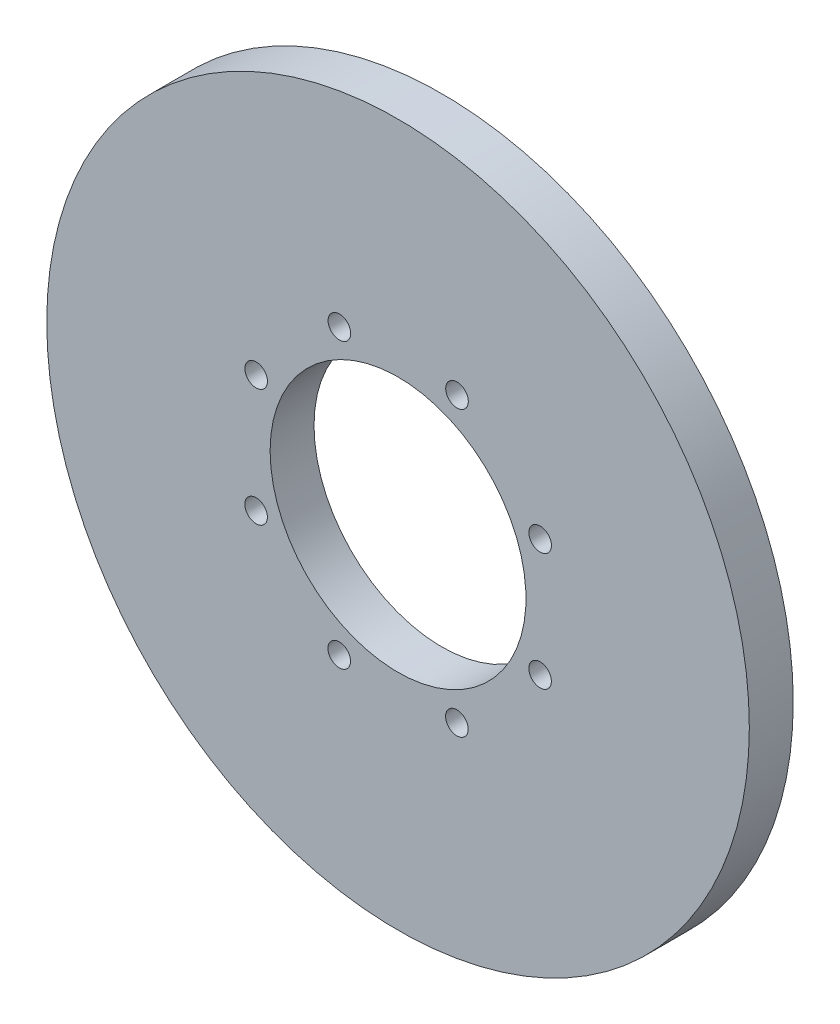
from build123d import *

# Parameters (mm, degrees)
SKETCH1_R                  = 152.4
BOSS_EXTRUDE1_DEPTH        = 19.05
SKETCH5_R                  = 55
CUT_EXTRUDE1_DEPTH         = 217.366407975
F_3_8_CLEARANCE_HOLE1_D    = 9.8044
NIPPLE_SOCKET_CLEARANCE_BY = 0.5


with BuildPart() as part:
    # Sketch1 → Boss-Extrude1 (new body)
    with BuildSketch(Plane.XY):
        Circle(SKETCH1_R)
    extrude(amount=BOSS_EXTRUDE1_DEPTH)

    # Sketch5 → Cut-Extrude1 (cut, through all)
    with BuildSketch(Plane(origin=(0, 0, 0), x_dir=(-1, 0, 0), z_dir=(0, 0, -1))):
        Circle(SKETCH5_R)
    extrude(amount=-CUT_EXTRUDE1_DEPTH, mode=Mode.SUBTRACT)

    # 3/8 Clearance Hole1 (through all)
    with Locations(Plane.XY.offset(19.05)):
        with Locations((25.523973959, -61.673028045), (61.624734649, -25.605296339), (61.648089668, 25.425534023), (25.580357962, 61.526294713), (-25.450472399, 61.549649732), (-61.55123309, 25.481918026), (-61.574588109, -25.548912335), (-25.506856403, -61.649673026)):
            Hole(F_3_8_CLEARANCE_HOLE1_D / 2)

    # nipple-socket-clearance: a curved face moved inward by 0.5
    add(Solid.thicken(part.faces().sort_by_distance((55, 0, 9.525))[0], -NIPPLE_SOCKET_CLEARANCE_BY), mode=Mode.SUBTRACT)


solid = part.part
